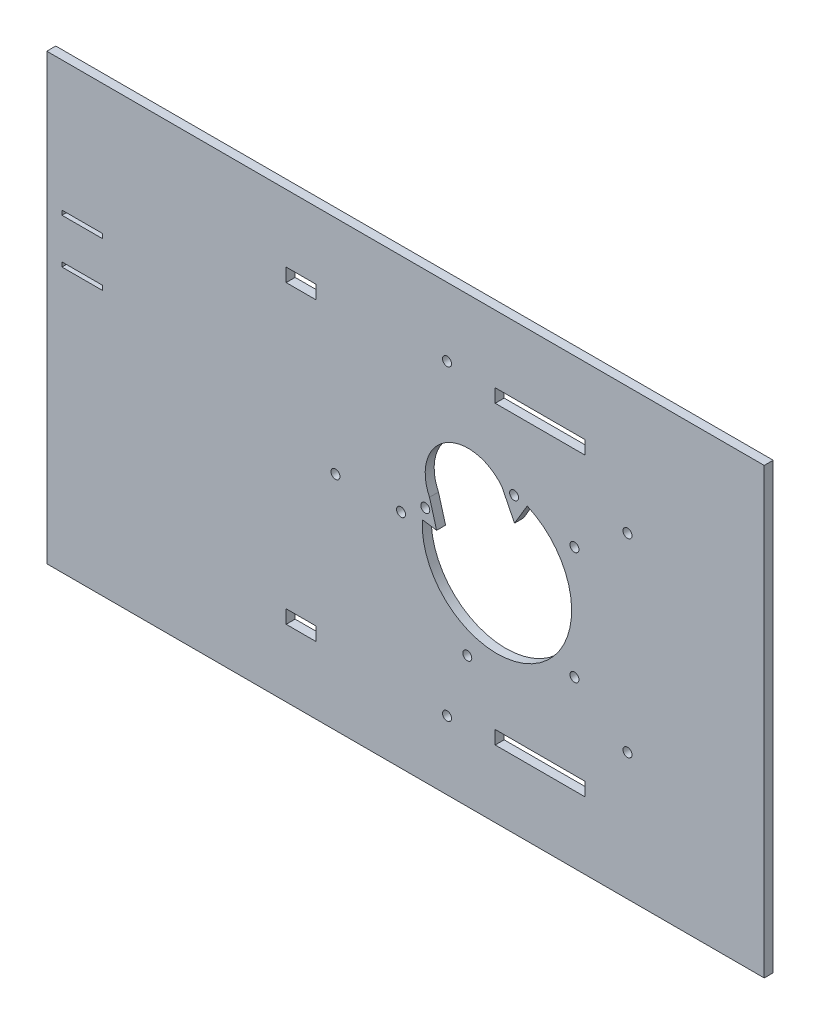
from build123d import *

# Parameters (mm, degrees)
SKETCH1_W           = 240.000854432
SKETCH1_H           = 148.499462854
SKETCH1_R           = 25
SKETCH1_W_2         = 13.501501462
SKETCH1_H_2         = 1.500166829
SKETCH1_H_3         = 1.501200358
SKETCH1_W_3         = 9.930659991
SKETCH1_H_4         = 4.500500488
SKETCH1_W_4         = 29.999719231
SKETCH1_H_5         = 4.500500487
SKETCH1_W_5         = 30.000235995
BOSS_EXTRUDE2_DEPTH = 3
SKETCH5_R           = 1.5
CUT_EXTRUDE4_DEPTH  = 10
SKETCH6_R           = 1.5
CUT_EXTRUDE5_DEPTH  = 10
SKETCH9_R           = 14.5
CUT_EXTRUDE6_DEPTH  = 10
BOSS_EXTRUDE4_START = -3
BOSS_EXTRUDE4_DEPTH = 3
CUT_EXTRUDE7_START  = -3
SKETCH14_R          = 1.5
CUT_EXTRUDE7_DEPTH  = 3


with BuildPart() as part:
    # Sketch1 → Boss-Extrude2 (new body)
    with BuildSketch(Plane.XY):
        Rectangle(SKETCH1_W, SKETCH1_H)
        with Locations((30.570227043, 0.001291911)):
            Circle(SKETCH1_R, mode=Mode.SUBTRACT)
        with Locations((-108.180218479, 30.002561435)):
            Rectangle(SKETCH1_W_2, SKETCH1_H_2, mode=Mode.SUBTRACT)
        with Locations((-108.180218479, 15.00037638)):
            Rectangle(SKETCH1_W_2, SKETCH1_H_3, mode=Mode.SUBTRACT)
        with Locations((-34.96659952, 49.499562569)):
            Rectangle(SKETCH1_W_3, SKETCH1_H_4, mode=Mode.SUBTRACT)
        with Locations((44.998545318, 49.499562569)):
            Rectangle(SKETCH1_W_4, SKETCH1_H_4, mode=Mode.SUBTRACT)
        with Locations((-34.96659952, -49.498529041)):
            Rectangle(SKETCH1_W_3, SKETCH1_H_5, mode=Mode.SUBTRACT)
        with Locations((45.000353993, -49.498529041)):
            Rectangle(SKETCH1_W_5, SKETCH1_H_5, mode=Mode.SUBTRACT)
    extrude(amount=BOSS_EXTRUDE2_DEPTH)

    # Sketch5 → Cut-Extrude4 (cut)
    with BuildSketch(Plane.XY.offset(3)):
        with Locations((-23.429772957, 0.001291911)):
            Circle(SKETCH5_R)
        with Locations((13.883309347, 51.358343791)):
            Circle(SKETCH5_R)
        with Locations((74.257144739, 31.741695535)):
            Circle(SKETCH5_R)
        with Locations((74.257144739, -31.739111713)):
            Circle(SKETCH5_R)
        with Locations((13.883309347, -51.355759969)):
            Circle(SKETCH5_R)
    extrude(amount=-CUT_EXTRUDE4_DEPTH, mode=Mode.SUBTRACT)

    # Sketch6 → Cut-Extrude5 (cut)
    with BuildSketch(Plane.XY.offset(3)):
        with Locations((-1.499999444, 0.001291911)):
            Circle(SKETCH6_R)
        with Locations((20.659982045, -30.499305969)):
            Circle(SKETCH6_R)
        with Locations((56.515585284, -18.849114256)):
            Circle(SKETCH6_R)
        with Locations((56.515585284, 18.851698077)):
            Circle(SKETCH6_R)
    extrude(amount=-CUT_EXTRUDE5_DEPTH, mode=Mode.SUBTRACT)

    # Sketch9 → Cut-Extrude6 (cut)
    with BuildSketch(Plane.XY.offset(3)):
        with Locations((21.045979743, 15.275083626)):
            Circle(SKETCH9_R)
    extrude(amount=-CUT_EXTRUDE6_DEPTH, mode=Mode.SUBTRACT)

    # Sketch13 → Boss-Extrude4 (add)
    with BuildSketch(Plane.XY.offset(3).offset(BOSS_EXTRUDE4_START)):
        with BuildLine():
            ThreePointArc((8.029540278, 9.039543161), (13.320857472, 27.50368773), (32.244528482, 24.214714051))
            Line((32.244528482, 24.214714051), (36.464610708, 15.736563351))
            Line((36.464610708, 15.736563351), (40.711520565, 22.851984804))
            ThreePointArc((40.711520565, 22.851984804), (39.274340999, 23.437127724), (37.803627931, 23.931981654))
            ThreePointArc((37.803627931, 23.931981654), (37.809425032, 23.856031132), (37.811359061, 23.779884249))
            ThreePointArc((37.811359061, 23.779884249), (35.885746907, 22.341533007), (35.052886669, 24.596123943))
            ThreePointArc((35.052886669, 24.596123943), (33.446845248, 24.835241812), (31.828668886, 24.969598304))
            ThreePointArc((31.828668886, 24.969598304), (13.373669418, 27.578971397), (7.59561948, 9.858644869))
            ThreePointArc((7.59561948, 9.858644869), (6.996783678, 8.325519677), (6.500127519, 6.756312925))
            ThreePointArc((6.500127519, 6.756312925), (7.632543085, 6.360125371), (8.112319615, 5.260514498))
            ThreePointArc((8.112319615, 5.260514498), (7.373043787, 3.967727302), (5.883921303, 3.949241872))
            ThreePointArc((5.883921303, 3.949241872), (5.710880965, 2.649482347), (5.606226413, 1.342437892))
            Line((5.606226413, 1.342437892), (10.396423525, 0.623978449))
            Line((10.396423525, 0.623978449), (8.029540278, 9.039543161))
        make_face()
    extrude(amount=BOSS_EXTRUDE4_DEPTH)

    # Sketch14 → Cut-Extrude7 (cut)
    with BuildSketch(Plane.XY.offset(3).offset(CUT_EXTRUDE7_START)):
        with Locations((36.311359061, 23.779884249)):
            Circle(SKETCH14_R)
        with Locations((6.612319615, 5.260514498)):
            Circle(SKETCH14_R)
    extrude(amount=CUT_EXTRUDE7_DEPTH, mode=Mode.SUBTRACT)


solid = part.part
